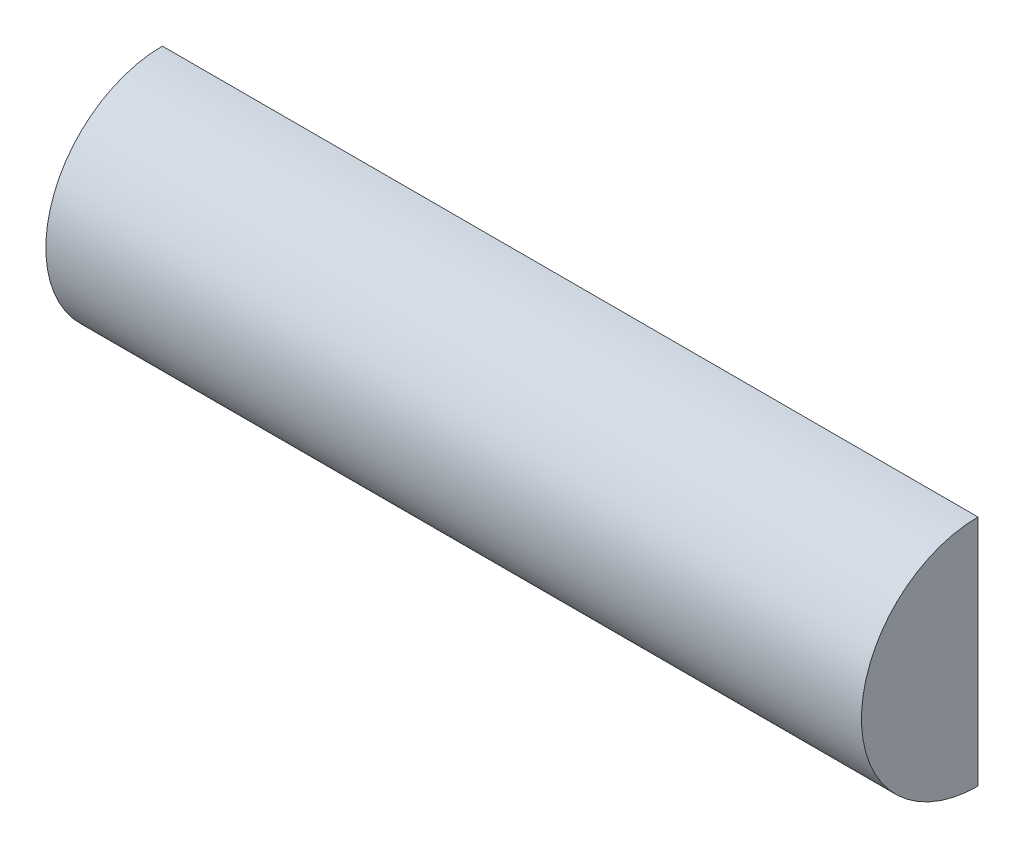
from build123d import *

# Parameters (mm, degrees)
FOREBODY_ANGLE = 180
SKETCH2_W      = 35000
SKETCH2_H      = 5000
FLUID_ANGLE    = 180
BOI_ANGLE      = 180


with BuildPart() as part:
    # Sketch1 → Forebody (revolve)
    with BuildSketch(Plane.XY):
        with BuildLine():
            Line((500, 0), (500, 40))
            Line((500, 40), (-350, 40))
            ThreePointArc((-350, 40), (-427.30823048, 30.482921921), (-500, 2.5))
            ThreePointArc((-500, 2.5), (-501.257357908, 1.455886326), (-502, 0))
            Line((-502, 0), (500, 0))
        make_face()
    revolve(axis=Axis((-668.954225757, 0, 0), (1, 0, 0)), revolution_arc=FOREBODY_ANGLE)


with BuildPart() as body_2:
    # Sketch2 → Fluid (revolve)
    with BuildSketch(Plane.XY):
        with Locations((7500, 2500)):
            Rectangle(SKETCH2_W, SKETCH2_H)
    revolve(axis=Axis((-10000, 0, 0), (1, 0, 0)), revolution_arc=FLUID_ANGLE)


with BuildPart() as body_3:
    # Sketch4 → BOI (revolve)
    with BuildSketch(Plane.XY):
        with BuildLine():
            Line((-622, 0), (3000, 0))
            Line((3000, 0), (3000, 120))
            Line((3000, 120), (-502, 120))
            ThreePointArc((-502, 120), (-586.852813742, 84.852813742), (-622, 0))
        make_face()
    revolve(axis=Axis((-668.954225757, 0, 0), (1, 0, 0)), revolution_arc=BOI_ANGLE)


solid = Compound([part.part, body_2.part, body_3.part])
